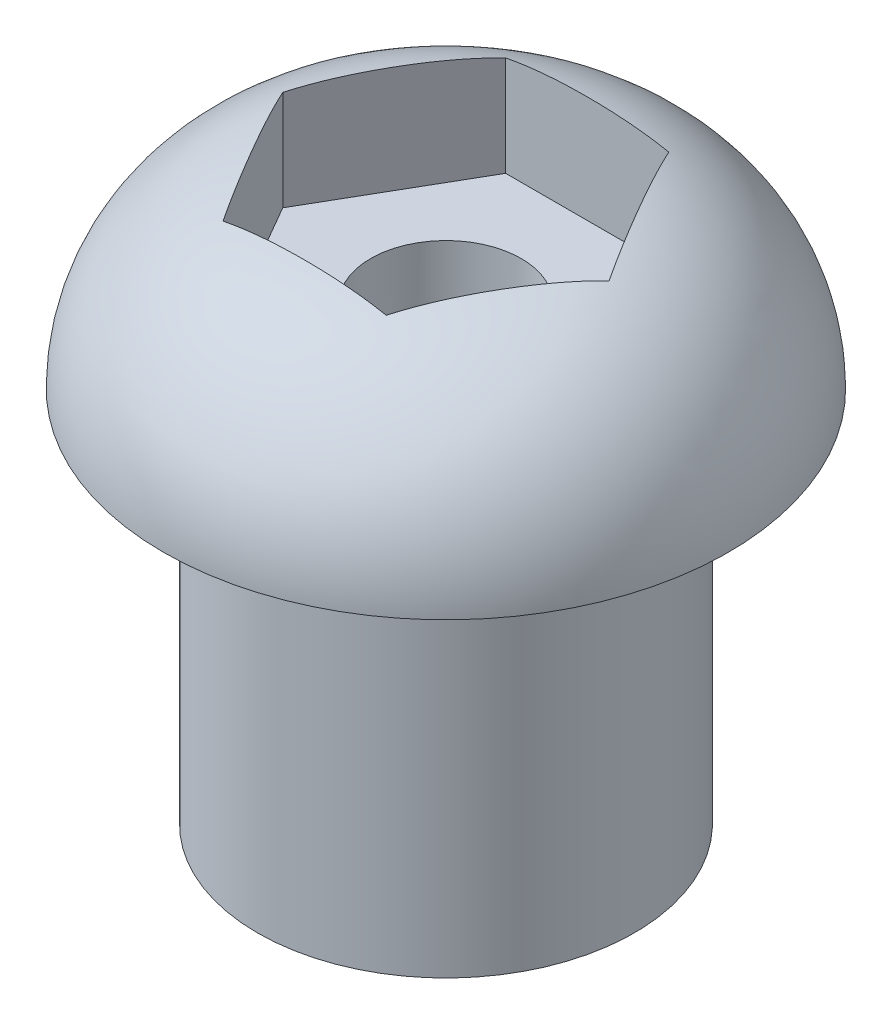
from build123d import *

# Parameters (mm, degrees)
CUT_EXTRUDE1_DEPTH = 1.905
CUT_EXTRUDE2_REACH = 12.17
SKETCH3_R          = 1.27
SKETCH4_R          = 2.3495
CUT_EXTRUDE3_DEPTH = 6.35
FILLET1_R          = 3.175


with BuildPart() as part:
    # Sketch1 → Revolve1 (revolve)
    with BuildSketch(Plane.XY, mode=Mode.PRIVATE) as revolve1_sk:
        Polygon((0, 0), (-3.175, 0), (-3.175, 6.35), (-4.7625, 6.35), (-4.7625, 9.525), (0, 9.525), align=None)
    revolve(revolve1_sk.sketch.rotate(Axis((0, 9.525, 0), (0, -1, 0)), 270), axis=Axis((0, 9.525, 0), (0, -1, 0)))

    # Sketch2 → Cut-Extrude1 (cut)
    with BuildSketch(Plane(origin=(0, 9.525, 0), x_dir=(1, 0, 0), z_dir=(0, 1, 0))):
        Polygon((-1.374815329, -2.38125), (1.374815329, -2.38125), (2.749630657, 0), (1.374815329, 2.38125), (-1.374815329, 2.38125), (-2.749630657, 0), align=None)
    extrude(amount=-CUT_EXTRUDE1_DEPTH, mode=Mode.SUBTRACT)

    # Sketch3 → Cut-Extrude2 (cut, up to next)
    with BuildSketch(Plane(origin=(0, 7.62, 0), x_dir=(1, 0, 0), z_dir=(0, 1, 0)), mode=Mode.PRIVATE) as cut_extrude2_sk1:
        with Locations(Location((0, 0, 0), (0, 0, 270))):
            Circle(SKETCH3_R)
    cut_extrude2_tool1 = extrude(cut_extrude2_sk1.sketch, amount=-CUT_EXTRUDE2_REACH, mode=Mode.PRIVATE) & part.part
    add(cut_extrude2_tool1.solids().sort_by_distance((0, 7.62, 0))[0], mode=Mode.SUBTRACT)

    # Sketch4 → Cut-Extrude3 (cut)
    with BuildSketch(Plane.XZ):
        with Locations(Location((0, 0, 0), (0, 0, 270))):
            Circle(SKETCH4_R)
    extrude(amount=-CUT_EXTRUDE3_DEPTH, mode=Mode.SUBTRACT)

    # Fillet1
    # the kernel refuses this fillet: 3.175 mm, written as the material it takes off along each edge
    with BuildSketch(Plane(origin=(0, 9.525, 0), x_dir=(0, 0, 1), z_dir=(1, 0, 0))) as fillet1_piece_1:
        with BuildLine():
            CenterArc((4.7625 - FILLET1_R, FILLET1_R), FILLET1_R, 270, 90)
            Line((4.7625 - FILLET1_R, 0), (4.7625, 0))
            Line((4.7625, 0), (4.7625, FILLET1_R))
        make_face()
    revolve(axis=Axis((0, 9.525, 0), (0, -1, 0)), mode=Mode.SUBTRACT)


solid = part.part
